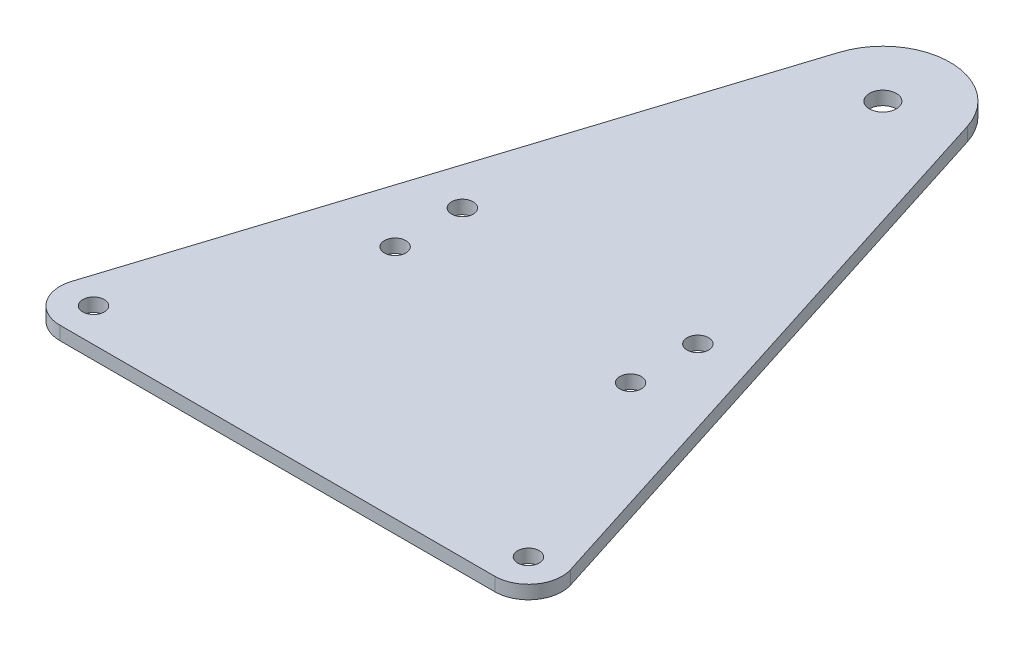
from build123d import *

# Parameters (mm, degrees)
SKETCH_1_W              = 150
SKETCH_1_H              = 200
EXTRUDE_1_DEPTH         = 2
CUT_EXTRUDE_1_REACH     = 127.016
SKETCH_2_R              = 2
CUT_EXTRUDE_2_REACH     = 127.016
SKETCH_3_R              = 1.6
CUT_EXTRUDE_3_REACH     = 127.016
SKETCH_5_R              = 1.6
CUT_EXTRUDE_START       = -2
CUT_EXTRUDE_4_OUTLINE_W = 150
CUT_EXTRUDE_4_OUTLINE_H = 200
CUT_EXTRUDE_4_DEPTH     = 2


# Read off the part's stored shape, not the designer's step: 切除-拉伸4
with BuildPart() as part:
    # 草图1 → 凸台-拉伸1 (new body)
    with BuildSketch(Plane(origin=(0, 0, 0), x_dir=(1, 0, 0), z_dir=(0, 1, 0))):
        Rectangle(SKETCH_1_W, SKETCH_1_H)
    extrude(amount=EXTRUDE_1_DEPTH)

    # 草图2 → 切除-拉伸1 (cut, up to next)
    with BuildSketch(Plane(origin=(0, 2, 0), x_dir=(1, 0, 0), z_dir=(0, 1, 0)), mode=Mode.PRIVATE) as cut_extrude_1_sk1:
        with Locations(Location((0, 80, 0), (0, 0, 270))):
            Circle(SKETCH_2_R)
    cut_extrude_1_tool1 = extrude(cut_extrude_1_sk1.sketch, amount=-CUT_EXTRUDE_1_REACH, mode=Mode.PRIVATE) & part.part
    add(cut_extrude_1_tool1.solids().sort_by_distance((0, 2, -80))[0], mode=Mode.SUBTRACT)

    # 草图3 → 切除-拉伸2 (cut, up to next)
    with BuildSketch(Plane(origin=(0, 2, 0), x_dir=(1, 0, 0), z_dir=(0, 1, 0)), mode=Mode.PRIVATE) as cut_extrude_2_sk1:
        with Locations(Location((-17.5, 35, 0), (0, 0, 270))):
            Circle(SKETCH_3_R)
    cut_extrude_2_tool1 = extrude(cut_extrude_2_sk1.sketch, amount=-CUT_EXTRUDE_2_REACH, mode=Mode.PRIVATE) & part.part
    # 草图3 → 切除-拉伸2 (cut, up to next)
    with BuildSketch(Plane(origin=(0, 2, 0), x_dir=(1, 0, 0), z_dir=(0, 1, 0)), mode=Mode.PRIVATE) as cut_extrude_2_sk2:
        with Locations(Location((-17.5, 25, 0), (0, 0, 90))):
            Circle(SKETCH_3_R)
    cut_extrude_2_tool2 = extrude(cut_extrude_2_sk2.sketch, amount=-CUT_EXTRUDE_2_REACH, mode=Mode.PRIVATE) & part.part
    # 草图3 → 切除-拉伸2 (cut, up to next)
    with BuildSketch(Plane(origin=(0, 2, 0), x_dir=(1, 0, 0), z_dir=(0, 1, 0)), mode=Mode.PRIVATE) as cut_extrude_2_sk3:
        with Locations(Location((17.5, 25, 0), (0, 0, 270))):
            Circle(SKETCH_3_R)
    cut_extrude_2_tool3 = extrude(cut_extrude_2_sk3.sketch, amount=-CUT_EXTRUDE_2_REACH, mode=Mode.PRIVATE) & part.part
    # 草图3 → 切除-拉伸2 (cut, up to next)
    with BuildSketch(Plane(origin=(0, 2, 0), x_dir=(1, 0, 0), z_dir=(0, 1, 0)), mode=Mode.PRIVATE) as cut_extrude_2_sk4:
        with Locations(Location((17.5, 35, 0), (0, 0, 90))):
            Circle(SKETCH_3_R)
    cut_extrude_2_tool4 = extrude(cut_extrude_2_sk4.sketch, amount=-CUT_EXTRUDE_2_REACH, mode=Mode.PRIVATE) & part.part
    add(cut_extrude_2_tool1.solids().sort_by_distance((-17.5, 2, -35))[0], mode=Mode.SUBTRACT)
    add(cut_extrude_2_tool2.solids().sort_by_distance((-17.5, 2, -25))[0], mode=Mode.SUBTRACT)
    add(cut_extrude_2_tool3.solids().sort_by_distance((17.5, 2, -25))[0], mode=Mode.SUBTRACT)
    add(cut_extrude_2_tool4.solids().sort_by_distance((17.5, 2, -35))[0], mode=Mode.SUBTRACT)

    # 草图5 → 切除-拉伸3 (cut, up to next)
    with BuildSketch(Plane(origin=(0, 2, 0), x_dir=(1, 0, 0), z_dir=(0, 1, 0)), mode=Mode.PRIVATE) as cut_extrude_3_sk1:
        with Locations(Location((32.32051615, -5, 0), (0, 0, 270))):
            Circle(SKETCH_5_R)
    cut_extrude_3_tool1 = extrude(cut_extrude_3_sk1.sketch, amount=-CUT_EXTRUDE_3_REACH, mode=Mode.PRIVATE) & part.part
    # 草图5 → 切除-拉伸3 (cut, up to next)
    with BuildSketch(Plane(origin=(0, 2, 0), x_dir=(1, 0, 0), z_dir=(0, 1, 0)), mode=Mode.PRIVATE) as cut_extrude_3_sk2:
        with Locations(Location((-32.32051615, -5, 0), (0, 0, 90))):
            Circle(SKETCH_5_R)
    cut_extrude_3_tool2 = extrude(cut_extrude_3_sk2.sketch, amount=-CUT_EXTRUDE_3_REACH, mode=Mode.PRIVATE) & part.part
    add(cut_extrude_3_tool1.solids().sort_by_distance((32.320516, 2, 5))[0], mode=Mode.SUBTRACT)
    add(cut_extrude_3_tool2.solids().sort_by_distance((-32.320516, 2, 5))[0], mode=Mode.SUBTRACT)

    # 切除-拉伸4 outline → 切除-拉伸4 (cut)
    with BuildSketch(Plane(origin=(0, 2, 0), x_dir=(1, 0, 0), z_dir=(0, 1, 0)).offset(CUT_EXTRUDE_START)):
        Rectangle(CUT_EXTRUDE_4_OUTLINE_W, CUT_EXTRUDE_4_OUTLINE_H)
        with BuildLine():
            ThreePointArc((-9.52836439, 83.034843002), (0, 90), (9.52836439, 83.034843002))
            Line((9.52836439, 83.034843002), (37.084698345, -3.482578499))
            ThreePointArc((37.084698345, -3.482578499), (36.357043587, -7.95066878), (32.32051615, -10))
            Line((32.32051615, -10), (-32.32051615, -10))
            ThreePointArc((-32.32051615, -10), (-36.357043587, -7.95066878), (-37.084698345, -3.482578499))
            Line((-37.084698345, -3.482578499), (-9.52836439, 83.034843002))
        make_face(mode=Mode.SUBTRACT)
    extrude(amount=CUT_EXTRUDE_4_DEPTH, mode=Mode.SUBTRACT)


solid = part.part
